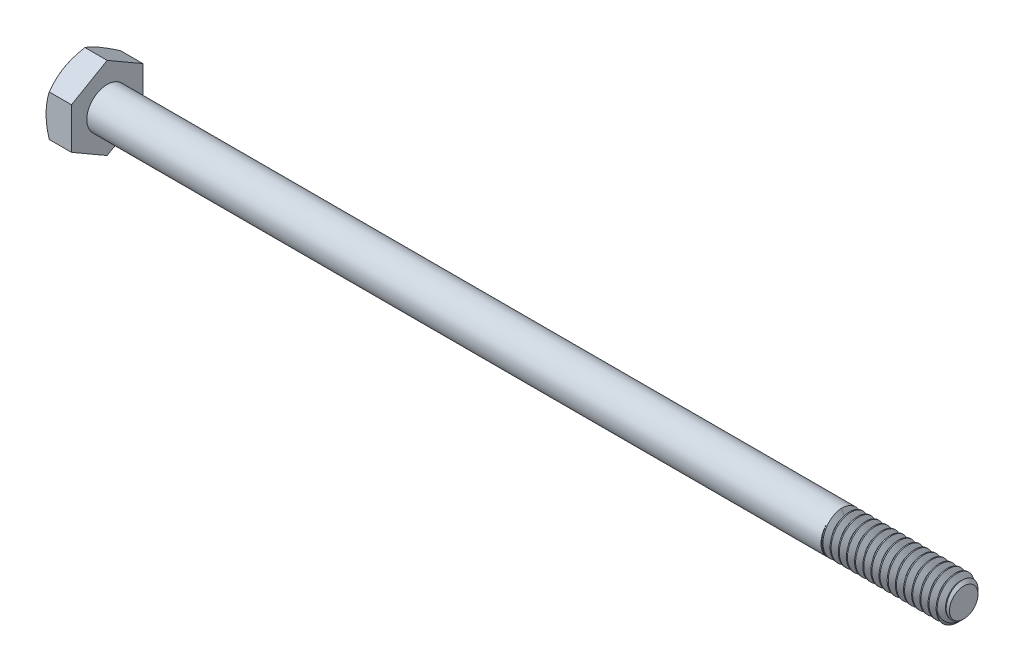
from build123d import *

# Parameters (mm, degrees)
SKETCH5_R           = 3.175
BOSS_EXTRUDE3_DEPTH = 133.35
CHAMFER1_SIZE       = 0.9525
BOSS_EXTRUDE4_DEPTH = 3.96875
SKETCH8_OUTSIDE_W   = 520.842
SKETCH8_OUTSIDE_H   = 522.562
SKETCH8_OUTSIDE_R   = 5.55625
CUT_EXTRUDE3_DEPTH  = 138.580789239
CUT_EXTRUDE3_DRAFT  = -60
CUT_EXTRUDE4_DEPTH  = 0.254
CIRPATTERN1_COUNT   = 6
CUT_SWEEP1_PITCH    = 1.27
CUT_SWEEP1_TO       = 19.05


with BuildPart() as part:
    # Sketch5 → Boss-Extrude3 (new body)
    with BuildSketch(Plane(origin=(68.659375, 0, 0), x_dir=(0, 0, -1), z_dir=(1, 0, 0))):
        Circle(SKETCH5_R)
    extrude(amount=-BOSS_EXTRUDE3_DEPTH)

    # Chamfer1
    chamfer1_edges = [part.edges().sort_by_distance(p)[0] for p in [
        (68.659375, 0, 3.175),
    ]]
    chamfer(chamfer1_edges, length=CHAMFER1_SIZE)

    # Sketch11 → Revolve1 (revolve)
    with BuildSketch(Plane.XY):
        Polygon((-64.690625, 3.175), (-64.690625, 0), (52.784375, 0), (49.609375, 3.175), align=None)
    revolve(axis=Axis((-64.690625, 0, 0), (1, 0, 0)))

    # Sketch6 → Boss-Extrude4 (add)
    with BuildSketch(Plane.ZY.offset(64.690625)):
        Polygon((5.55625, 3.207902433), (0, 6.415804866), (-5.55625, 3.207902433), (-5.55625, -3.207902433), (0, -6.415804866), (5.55625, -3.207902433), align=None)
    extrude(amount=BOSS_EXTRUDE4_DEPTH)


with BuildPart() as cut_extrude3_tool:
    # Sketch8 outside → Cut-Extrude3 (with draft: the straight prism first)
    with BuildSketch(Plane.ZY.offset(68.659375)):
        Rectangle(SKETCH8_OUTSIDE_W, SKETCH8_OUTSIDE_H)
        Circle(SKETCH8_OUTSIDE_R, mode=Mode.SUBTRACT)
    extrude(amount=-CUT_EXTRUDE3_DEPTH)
    # Cut-Extrude3: the draft: its side faces are tilted about the plane it starts from
    cut_extrude3_sides = [cut_extrude3_tool.faces().sort_by_distance(p)[0] for p in [
        (0.63101962, -261.281, 0),
        (0.63101962, 0, 260.421),
        (0.63101962, 261.281, 0),
        (0.63101962, 0, -260.421),
        (0.63101962, 0, -5.55625),
    ]]
    draft(cut_extrude3_sides, Plane.ZY.offset(68.659375), CUT_EXTRUDE3_DRAFT)


with BuildPart() as part_1:
    add(part.part)

    # Cut-Extrude3: cut by cut_extrude3_tool
    add(cut_extrude3_tool.part, mode=Mode.SUBTRACT)

    # Sketch12 → Cut-Extrude4 (cut)
    with BuildSketch(Plane.ZY.offset(68.659375)):
        with BuildLine():
            Line((0.1666875, 4.2783125), (0.1666875, 2.3891875))
            ThreePointArc((0.1666875, 2.3891875), (0, 2.2225), (-0.1666875, 2.3891875))
            Line((-0.1666875, 2.3891875), (-0.1666875, 4.2783125))
            ThreePointArc((-0.1666875, 4.2783125), (0, 4.445), (0.1666875, 4.2783125))
        make_face()
    cut_extrude4 = extrude(amount=-CUT_EXTRUDE4_DEPTH, mode=Mode.SUBTRACT)

    # CirPattern1: Cut-Extrude4 ×6 about axis
    cirpattern1_axis = Axis((0, 0, 0), (1, 0, 0))
    for i in range(1, CIRPATTERN1_COUNT):
        add(cut_extrude4.rotate(cirpattern1_axis, i * 360 / CIRPATTERN1_COUNT), mode=Mode.SUBTRACT)


with BuildPart() as body_2:
    # Split1: the piece on the far side of the plane
    add(part_1.part)
    split(bisect_by=Plane(origin=(49.609375, 0, 0), x_dir=(0, 0, 1), z_dir=(1, 0, 0)), keep=Keep.BOTTOM)


with BuildPart() as part_2:
    add(part_1.part)

    # Split1
    split(bisect_by=Plane(origin=(49.609375, 0, 0), x_dir=(0, 0, 1), z_dir=(1, 0, 0)), keep=Keep.TOP)

    # Cut-Sweep1: arcs per turn and ends read off the stored shape
    # Cut-Sweep1: the profile of Sketch10 profile screwed along a right-hand helix through 16 turns, 8 arcs to a turn; built about Z, then put on its axis
    cut_sweep1_z = Axis((0, 0, 0), (0, 0, 1))
    cut_sweep1_corners = [(3.1753, 0, 0.000173205), (2.350110803, 0, -0.47625), (2.350110803, 0, -0.635), (3.1753, 0, -1.111423205)]
    with BuildLine(mode=Mode.PRIVATE) as cut_sweep1_profile:
        Line(cut_sweep1_corners[0], cut_sweep1_corners[1])
        Line(cut_sweep1_corners[1], cut_sweep1_corners[2])
        Line(cut_sweep1_corners[2], cut_sweep1_corners[3])
        Line(cut_sweep1_corners[3], cut_sweep1_corners[0])
    cut_sweep1_cap = Face(cut_sweep1_profile.wire())
    cut_sweep1_turn_angles = [0, 22.5, 45, 67.5, 90, 112.5, 135, 157.5, 180, 202.5, 225, 247.5, 270, 292.5, 315, 337.5, 360]
    cut_sweep1_turn_weights = [1, 0.9238795325112867, 1, 0.9238795325112867, 1, 0.9238795325112867, 1, 0.9238795325112867, 1, 0.9238795325112867, 1, 0.9238795325112867, 1, 0.9238795325112867, 1, 0.9238795325112867, 1]
    cut_sweep1_turn_rails = [Edge.make_bspline([Vector(p[0], p[1], 0).rotate(cut_sweep1_z, cut_sweep1_turn_angles[k]) / cut_sweep1_turn_weights[k] + Vector(0, 0, p[2] + CUT_SWEEP1_PITCH * cut_sweep1_turn_angles[k] / 360) for k in range(17)], [0, 0, 0, 1, 1, 2, 2, 3, 3, 4, 4, 5, 5, 6, 6, 7, 7, 8, 8, 8], 2, cut_sweep1_turn_weights) for p in cut_sweep1_corners]
    cut_sweep1_turn_sides = [Face.make_surface_from_curves(cut_sweep1_turn_rails[p[0]], cut_sweep1_turn_rails[p[1]]) for p in [(0, 1), (1, 2), (2, 3), (3, 0)]]
    cut_sweep1 = Plane(origin=(68.659375, 0, 0), x_dir=(0, 1, 0), z_dir=(-1, 0, 0)) * split(Solid(Shell([*[p.moved(Location((0, 0, CUT_SWEEP1_PITCH * i))) for i in range(16) for p in cut_sweep1_turn_sides], cut_sweep1_cap, cut_sweep1_cap.rotate(cut_sweep1_z, 5760).moved(Location((0, 0, CUT_SWEEP1_PITCH * 5760 / 360)))])), bisect_by=Plane.XY.offset(CUT_SWEEP1_TO), keep=Keep.BOTTOM, mode=Mode.PRIVATE)
    add(cut_sweep1, mode=Mode.SUBTRACT)


with BuildPart() as boss_extrude5_tool:
    # Boss-Extrude5: read off the stored shape, not the designer's step
    # Boss-Extrude5 outline → Boss-Extrude5 (revolve)
    with BuildSketch(Plane.YX):
        Polygon((3.175, 49.609375), (2.35010135, 50.085630458), (2.35010135, 49.609375), align=None)
    revolve(axis=Axis((0, 0, 0), (1, 0, 0)))


with BuildPart() as part_3:
    add(part_2.part)


with BuildPart() as part_4:
    # Boss-Extrude5: joined with boss_extrude5_tool
    add(part_3.part.fuse(boss_extrude5_tool.part, body_2.part, tol=0.00001))


solid = part_4.part
